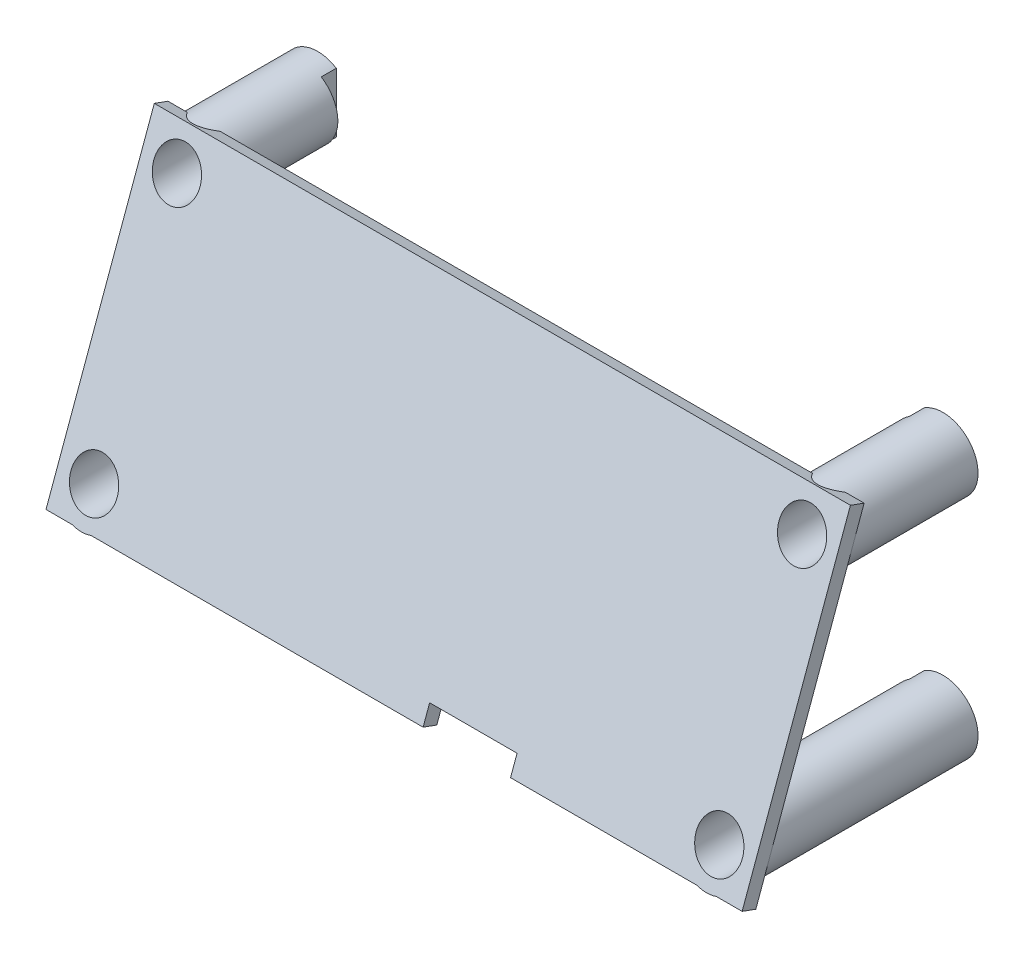
from build123d import *

# Parameters (mm, degrees)
LCD_MOUNT_TUBE_OUTLINE_R          = 4.826
LCD_MOUNT_TUBE_DEPTH              = 17.560061263
LCD_START                         = 17.560061263
LCD_MOUNT_TUBE_2_OUTLINE_R        = 4.826
LCD_MOUNT_TUBE_2_DEPTH            = 3.513040701
LCD_START_2                       = 43.178154287
LCD_MOUNT_TUBE_3_OUTLINE_W        = 13
LCD_MOUNT_TUBE_3_OUTLINE_H        = 13
LCD_MOUNT_TUBE_3_DEPTH            = 3.821845713
LCD_MOUNT_TUBE_4_OUTLINE_R        = 4.826
LCD_MOUNT_TUBE_4_DEPTH            = 17.560060851
LCD_START_3                       = 17.560060851
LCD_MOUNT_TUBE_5_OUTLINE_R        = 4.826
LCD_MOUNT_TUBE_5_DEPTH            = 3.513040701
LCD_MOUNT_TUBE_6_OUTLINE_W        = 12
LCD_MOUNT_TUBE_6_OUTLINE_H        = 13
LCD_MOUNT_TUBE_6_DEPTH            = 3.821845713
LCD_MOUNT_TUBE_7_OUTLINE_R        = 4.826
LCD_MOUNT_TUBE_7_DEPTH            = 28.925419555
LCD_START_4                       = 28.925419555
LCD_MOUNT_TUBE_8_OUTLINE_R        = 4.826
LCD_MOUNT_TUBE_8_DEPTH            = 3.513040701
LCD_MOUNT_TUBE_9_OUTLINE_W        = 12
LCD_MOUNT_TUBE_9_OUTLINE_H        = 14
LCD_MOUNT_TUBE_9_DEPTH            = 3.821845713
LCD_MOUNT_TUBE_10_OUTLINE_R       = 4.826
LCD_MOUNT_TUBE_10_DEPTH           = 28.925419967
LCD_START_5                       = 28.925419967
LCD_MOUNT_TUBE_11_OUTLINE_R       = 4.826
LCD_MOUNT_TUBE_11_DEPTH           = 3.513040701
LCD_MOUNT_TUBE_12_OUTLINE_W       = 13
LCD_MOUNT_TUBE_12_OUTLINE_H       = 14
LCD_MOUNT_TUBE_12_DEPTH           = 3.821845713
TUBE_PCB_INTERFERENCE_DEPTH       = 2.064
SKETCH3_R                         = 1.3
SCREW_HOLE_DEPTH                  = 114.618937328
SKETCH4_W                         = 95.52
SKETCH4_H                         = 43.45
BACK_PLATE_DEPTH                  = 2
HOLLOW_START                      = -3.8
SKETCH2_R                         = 3.175
HOLLOW_TUBE_DEPTH                 = 110.960288991
SKETCH7_W                         = 12
SKETCH7_H                         = 7.1
USB_CLEARANCE_DEPTH               = 3
SCREW_CATCHING_FUNNEL_OUTLINE_R   = 2.2225
SCREW_CATCHING_FUNNEL_DEPTH       = 2.159
SCREW_CATCHING_FUNNEL_DRAFT       = -20
SCREW_CATCHING_FUNNEL_2_OUTLINE_R = 2.2225
SCREW_CATCHING_FUNNEL_2_DEPTH     = 2.159
SCREW_CATCHING_FUNNEL_2_DRAFT     = -20
SCREW_CATCHING_FUNNEL_3_OUTLINE_R = 2.2225
SCREW_CATCHING_FUNNEL_3_DEPTH     = 2.159
SCREW_CATCHING_FUNNEL_3_DRAFT     = -20
SCREW_CATCHING_FUNNEL_4_OUTLINE_R = 2.2225
SCREW_CATCHING_FUNNEL_4_DEPTH     = 2.159
SCREW_CATCHING_FUNNEL_4_DRAFT     = -20


with BuildPart() as part:
    # LCD mount tube: read off the stored shape, not the designer's step
    # LCD mount tube outline → LCD mount tube (new body)
    with BuildSketch(Plane.XY):
        with Locations((14.630315517, 73.17260569)):
            Circle(LCD_MOUNT_TUBE_OUTLINE_R)
    extrude(amount=LCD_MOUNT_TUBE_DEPTH)

    # LCD mount tube 2 outline → LCD mount tube 2 (add)
    with BuildSketch(Plane.XY.offset(LCD_START)):
        with Locations((14.630315517, 73.17260569)):
            Circle(LCD_MOUNT_TUBE_2_OUTLINE_R)
    extrude(amount=LCD_MOUNT_TUBE_2_DEPTH)

    # LCD mount tube 3 outline → LCD mount tube 3 (cut)
    with BuildSketch(Plane(origin=(0, 0, 0), x_dir=(1, 0, 0), z_dir=(0, 0.3420201433257131, 0.9396926207858923)).offset(LCD_START_2)):
        with Locations((14.5, 62.5)):
            Rectangle(LCD_MOUNT_TUBE_3_OUTLINE_W, LCD_MOUNT_TUBE_3_OUTLINE_H)
    extrude(amount=LCD_MOUNT_TUBE_3_DEPTH, mode=Mode.SUBTRACT)


with BuildPart() as body_2:
    # LCD mount tube 4 outline → LCD mount tube 4 (new body)
    with BuildSketch(Plane.XY):
        with Locations((-71.155750897, 73.172606822)):
            Circle(LCD_MOUNT_TUBE_4_OUTLINE_R)
    extrude(amount=LCD_MOUNT_TUBE_4_DEPTH)

    # LCD mount tube 5 outline → LCD mount tube 5 (add)
    with BuildSketch(Plane.XY.offset(LCD_START_3)):
        with Locations((-71.155750897, 73.172606822)):
            Circle(LCD_MOUNT_TUBE_5_OUTLINE_R)
    extrude(amount=LCD_MOUNT_TUBE_5_DEPTH)

    # LCD mount tube 6 outline → LCD mount tube 6 (cut)
    with BuildSketch(Plane(origin=(0, 0, 0), x_dir=(1, 0, 0), z_dir=(0, 0.3420201433257131, 0.9396926207858923)).offset(LCD_START_2)):
        with Locations((-71, 62.5)):
            Rectangle(LCD_MOUNT_TUBE_6_OUTLINE_W, LCD_MOUNT_TUBE_6_OUTLINE_H)
    extrude(amount=LCD_MOUNT_TUBE_6_DEPTH, mode=Mode.SUBTRACT)


with BuildPart() as body_3:
    # LCD mount tube 7 outline → LCD mount tube 7 (new body)
    with BuildSketch(Plane.XY):
        with Locations((-71.155751248, 41.946540419)):
            Circle(LCD_MOUNT_TUBE_7_OUTLINE_R)
    extrude(amount=LCD_MOUNT_TUBE_7_DEPTH)

    # LCD mount tube 8 outline → LCD mount tube 8 (add)
    with BuildSketch(Plane.XY.offset(LCD_START_4)):
        with Locations((-71.155751248, 41.946540419)):
            Circle(LCD_MOUNT_TUBE_8_OUTLINE_R)
    extrude(amount=LCD_MOUNT_TUBE_8_DEPTH)

    # LCD mount tube 9 outline → LCD mount tube 9 (cut)
    with BuildSketch(Plane(origin=(0, 0, 0), x_dir=(1, 0, 0), z_dir=(0, 0.3420201433257131, 0.9396926207858923)).offset(LCD_START_2)):
        with Locations((-71, 29)):
            Rectangle(LCD_MOUNT_TUBE_9_OUTLINE_W, LCD_MOUNT_TUBE_9_OUTLINE_H)
    extrude(amount=LCD_MOUNT_TUBE_9_DEPTH, mode=Mode.SUBTRACT)


with BuildPart() as body_4:
    # LCD mount tube 10 outline → LCD mount tube 10 (new body)
    with BuildSketch(Plane.XY):
        with Locations((14.630315166, 41.946539286)):
            Circle(LCD_MOUNT_TUBE_10_OUTLINE_R)
    extrude(amount=LCD_MOUNT_TUBE_10_DEPTH)

    # LCD mount tube 11 outline → LCD mount tube 11 (add)
    with BuildSketch(Plane.XY.offset(LCD_START_5)):
        with Locations((14.630315166, 41.946539286)):
            Circle(LCD_MOUNT_TUBE_11_OUTLINE_R)
    extrude(amount=LCD_MOUNT_TUBE_11_DEPTH)

    # LCD mount tube 12 outline → LCD mount tube 12 (cut)
    with BuildSketch(Plane(origin=(0, 0, 0), x_dir=(1, 0, 0), z_dir=(0, 0.3420201433257131, 0.9396926207858923)).offset(LCD_START_2)):
        with Locations((14.5, 29)):
            Rectangle(LCD_MOUNT_TUBE_12_OUTLINE_W, LCD_MOUNT_TUBE_12_OUTLINE_H)
    extrude(amount=LCD_MOUNT_TUBE_12_DEPTH, mode=Mode.SUBTRACT)


with BuildPart() as tube_pcb_interference_tool:
    # Sketch5 → tube PCB interference (new body)
    with BuildSketch(Plane.XY):
        Polygon((12.082314183, 81.622175529), (8.870527881, 81.622175529), (8.870527362, 35.408676422), (12.082313664, 35.408676422), align=None)
        Polygon((-65.395963072, 81.622175529), (-68.607749373, 81.622175529), (-68.607749893, 35.408676422), (-65.395963591, 35.408676422), align=None)
    extrude(amount=TUBE_PCB_INTERFERENCE_DEPTH)


with BuildPart() as part_1:
    add(part.part)

    # tube PCB interference: cut by tube_pcb_interference_tool
    add(tube_pcb_interference_tool.part, mode=Mode.SUBTRACT)


with BuildPart() as body_2_1:
    add(body_2.part)

    # tube PCB interference: cut by tube_pcb_interference_tool
    add(tube_pcb_interference_tool.part, mode=Mode.SUBTRACT)


with BuildPart() as body_3_1:
    add(body_3.part)

    # tube PCB interference: cut by tube_pcb_interference_tool
    add(tube_pcb_interference_tool.part, mode=Mode.SUBTRACT)


with BuildPart() as body_4_1:
    add(body_4.part)

    # tube PCB interference: cut by tube_pcb_interference_tool
    add(tube_pcb_interference_tool.part, mode=Mode.SUBTRACT)


with BuildPart() as screw_hole_tool:
    # Sketch3 → screw hole (new, through all)
    with BuildSketch(Plane(origin=(0, 0, 0), x_dir=(-1, 0, 0), z_dir=(0, 0, -1))):
        with Locations((71.155750897, 73.172606822)):
            Circle(SKETCH3_R)
        with Locations((71.155751248, 41.946540419)):
            Circle(SKETCH3_R)
        with Locations((-14.630315166, 41.946539286)):
            Circle(SKETCH3_R)
        with Locations((-14.630315517, 73.17260569)):
            Circle(SKETCH3_R)
    extrude(amount=-SCREW_HOLE_DEPTH)


with BuildPart() as part_2:
    add(part_1.part)

    # screw hole: cut by screw_hole_tool
    add(screw_hole_tool.part, mode=Mode.SUBTRACT)



with BuildPart() as body_2_2:
    add(body_2_1.part)

    # screw hole: cut by screw_hole_tool
    add(screw_hole_tool.part, mode=Mode.SUBTRACT)


with BuildPart() as body_3_2:
    add(body_3_1.part)

    # screw hole: cut by screw_hole_tool
    add(screw_hole_tool.part, mode=Mode.SUBTRACT)


with BuildPart() as body_4_2:
    add(body_4_1.part)

    # screw hole: cut by screw_hole_tool
    add(screw_hole_tool.part, mode=Mode.SUBTRACT)


with BuildPart() as part_3:
    add(part_2.part)

    add(body_2_2.part)  # back plate merges body 2

    add(body_3_2.part)  # back plate merges body 3

    add(body_4_2.part)  # back plate merges body 4
    # Sketch4 → back plate (add)
    with BuildSketch(Plane(origin=(0, 14.767798518, 40.574192962), x_dir=(1, 0, 0), z_dir=(-8.110156480009166e-14, 0.3420201433257126, 0.9396926207858924))):
        with Locations((-28.301906678, 45.699826265)):
            Rectangle(SKETCH4_W, SKETCH4_H)
    extrude(amount=-BACK_PLATE_DEPTH)

    # Sketch2 → hollow tube (cut, through all)
    with BuildSketch(Plane(origin=(0, 0, 0), x_dir=(-1, 0, 0), z_dir=(0, 0, -1)).offset(HOLLOW_START)):
        with Locations((71.155750897, 73.172606822)):
            Circle(SKETCH2_R)
        with Locations((71.155751248, 41.946540419)):
            Circle(SKETCH2_R)
        with Locations((-14.630315166, 41.946539286)):
            Circle(SKETCH2_R)
        with Locations((-14.630315517, 73.17260569)):
            Circle(SKETCH2_R)
    extrude(amount=-HOLLOW_TUBE_DEPTH, mode=Mode.SUBTRACT)

    # Sketch7 → USB clearance (cut)
    with BuildSketch(Plane(origin=(0, 14.767798518, 40.574192962), x_dir=(1, 0, 0), z_dir=(-8.110156480009166e-14, 0.3420201433257126, 0.9396926207858924))):
        with Locations((-18.317358646, 23.042126287)):
            Rectangle(SKETCH7_W, SKETCH7_H)
    extrude(amount=-USB_CLEARANCE_DEPTH, mode=Mode.SUBTRACT)


with BuildPart() as screw_catching_funnel_tool:
    # screw catching funnel: read off the stored shape, not the designer's step
    # screw catching funnel outline → screw catching funnel (with draft: the straight prism first)
    with BuildSketch(Plane.XY.offset(1.641)):
        with Locations((14.630315517, 73.17260569)):
            Circle(SCREW_CATCHING_FUNNEL_OUTLINE_R)
        with BuildLine():
            ThreePointArc((13.330315517, 73.17260569), (14.630315517, 74.47260569), (15.930315517, 73.17260569))
            ThreePointArc((15.930315517, 73.17260569), (14.630315517, 71.87260569), (13.330315517, 73.17260569))
        make_face(mode=Mode.SUBTRACT)
    extrude(amount=SCREW_CATCHING_FUNNEL_DEPTH)
    # screw catching funnel: the draft: its side faces are tilted about the plane it starts from
    screw_catching_funnel_sides = [screw_catching_funnel_tool.faces().sort_by_distance(p)[0] for p in [
        (12.407815517, 73.17260569, 2.7205),
        (13.330315517, 73.17260569, 2.7205),
    ]]
    draft(screw_catching_funnel_sides, Plane.XY.offset(1.641), SCREW_CATCHING_FUNNEL_DRAFT)


with BuildPart() as part_4:
    add(part_3.part)

    # screw catching funnel: cut by screw_catching_funnel_tool
    add(screw_catching_funnel_tool.part, mode=Mode.SUBTRACT)


with BuildPart() as screw_catching_funnel_2_tool:
    # screw catching funnel 2 outline → screw catching funnel 2 (with draft: the straight prism first)
    with BuildSketch(Plane.XY.offset(1.641)):
        with Locations((14.630315166, 41.946539286)):
            Circle(SCREW_CATCHING_FUNNEL_2_OUTLINE_R)
        with BuildLine():
            ThreePointArc((13.330315166, 41.946539286), (14.630315166, 43.246539286), (15.930315166, 41.946539286))
            ThreePointArc((15.930315166, 41.946539286), (14.630315166, 40.646539286), (13.330315166, 41.946539286))
        make_face(mode=Mode.SUBTRACT)
    extrude(amount=SCREW_CATCHING_FUNNEL_2_DEPTH)
    # screw catching funnel 2: the draft: its side faces are tilted about the plane it starts from
    screw_catching_funnel_2_sides = [screw_catching_funnel_2_tool.faces().sort_by_distance(p)[0] for p in [
        (12.407815166, 41.946539286, 2.7205),
        (15.930315166, 41.946539286, 2.7205),
    ]]
    draft(screw_catching_funnel_2_sides, Plane.XY.offset(1.641), SCREW_CATCHING_FUNNEL_2_DRAFT)


with BuildPart() as part_5:
    add(part_4.part)

    # screw catching funnel 2: cut by screw_catching_funnel_2_tool
    add(screw_catching_funnel_2_tool.part, mode=Mode.SUBTRACT)


with BuildPart() as screw_catching_funnel_3_tool:
    # screw catching funnel 3 outline → screw catching funnel 3 (with draft: the straight prism first)
    with BuildSketch(Plane.XY.offset(1.641)):
        with Locations((-71.155751248, 41.946540419)):
            Circle(SCREW_CATCHING_FUNNEL_3_OUTLINE_R)
        with BuildLine():
            ThreePointArc((-72.455751248, 41.946540419), (-71.155751248, 43.246540419), (-69.855751248, 41.946540419))
            ThreePointArc((-69.855751248, 41.946540419), (-71.155751248, 40.646540419), (-72.455751248, 41.946540419))
        make_face(mode=Mode.SUBTRACT)
    extrude(amount=SCREW_CATCHING_FUNNEL_3_DEPTH)
    # screw catching funnel 3: the draft: its side faces are tilted about the plane it starts from
    screw_catching_funnel_3_sides = [screw_catching_funnel_3_tool.faces().sort_by_distance(p)[0] for p in [
        (-73.378251248, 41.946540419, 2.7205),
        (-69.855751248, 41.946540419, 2.7205),
    ]]
    draft(screw_catching_funnel_3_sides, Plane.XY.offset(1.641), SCREW_CATCHING_FUNNEL_3_DRAFT)


with BuildPart() as part_6:
    add(part_5.part)

    # screw catching funnel 3: cut by screw_catching_funnel_3_tool
    add(screw_catching_funnel_3_tool.part, mode=Mode.SUBTRACT)


with BuildPart() as screw_catching_funnel_4_tool:
    # screw catching funnel 4 outline → screw catching funnel 4 (with draft: the straight prism first)
    with BuildSketch(Plane.XY.offset(1.641)):
        with Locations((-71.155750897, 73.172606822)):
            Circle(SCREW_CATCHING_FUNNEL_4_OUTLINE_R)
        with BuildLine():
            ThreePointArc((-72.455750897, 73.172606822), (-71.155750897, 74.472606822), (-69.855750897, 73.172606822))
            ThreePointArc((-69.855750897, 73.172606822), (-71.155750897, 71.872606822), (-72.455750897, 73.172606822))
        make_face(mode=Mode.SUBTRACT)
    extrude(amount=SCREW_CATCHING_FUNNEL_4_DEPTH)
    # screw catching funnel 4: the draft: its side faces are tilted about the plane it starts from
    screw_catching_funnel_4_sides = [screw_catching_funnel_4_tool.faces().sort_by_distance(p)[0] for p in [
        (-73.378250897, 73.172606822, 2.7205),
        (-69.855750897, 73.172606822, 2.7205),
    ]]
    draft(screw_catching_funnel_4_sides, Plane.XY.offset(1.641), SCREW_CATCHING_FUNNEL_4_DRAFT)


with BuildPart() as part_7:
    add(part_6.part)

    # screw catching funnel 4: cut by screw_catching_funnel_4_tool
    add(screw_catching_funnel_4_tool.part, mode=Mode.SUBTRACT)


solid = part_7.part
